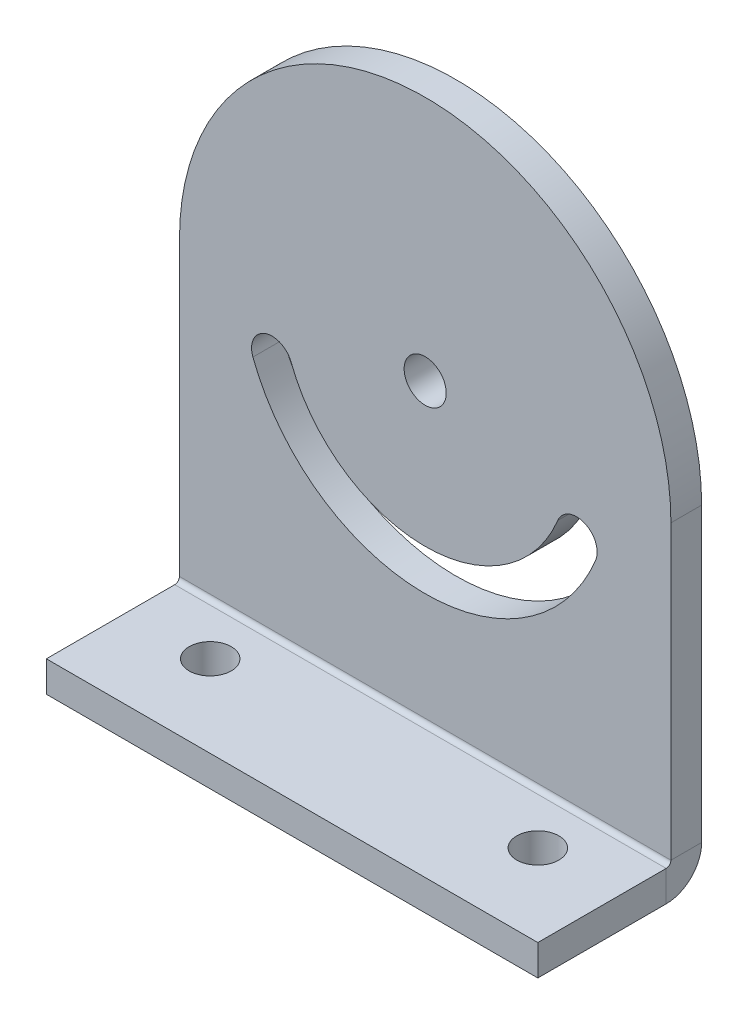
from build123d import *

# Parameters (mm, degrees)
BASE_FLANGE1_DEPTH                = 4.7625
EDGE_FLANGE2_STRIP_W              = 20.5232
EDGE_FLANGE2_STRIP_H              = 4.7625
EDGE_FLANGE2_STRIP_CUT_DEPTH      = 76.2
EDGE_FLANGE2_DEPTH                = 76.2
F_1_4_START                       = -50.8
F_1_4_CLEARANCE_HOLE3_OUTLINE_R   = 3.2639
F_1_4_CLEARANCE_HOLE3_DEPTH       = 4.7625
F_1_4_START_2                     = -4.7625
F_1_4_CLEARANCE_HOLE3_2_OUTLINE_R = 3.2639
F_1_4_CLEARANCE_HOLE3_2_DEPTH     = 4.7625
CUT_EXTRUDE1_DEPTH                = 94.877507457


# Read off the part's stored shape, not the designer's step: 1/4 Clearance Hole3
# Sheet-metal steps are written as plain solids
with BuildPart() as part:
    # Sketch1 → Base-Flange1 (new body)
    with BuildSketch(Plane.XY):
        with BuildLine():
            Line((0, 0), (0, -50.8))
            Line((0, -50.8), (-76.2, -50.8))
            Line((-76.2, -50.8), (-76.2, 0))
            ThreePointArc((-76.2, 0), (-38.1, 38.1), (0, 0))
        make_face()
    extrude(amount=-BASE_FLANGE1_DEPTH)

    # Edge-Flange2 strip (across the edge) → Edge-Flange2 strip cut (cut)
    with BuildSketch(Plane(origin=(-76.2, -50.8, 0), x_dir=(0, 1, 0), z_dir=(1, 0, 0))):
        with Locations((-4.7625, -2.38125)):
            Rectangle(EDGE_FLANGE2_STRIP_W, EDGE_FLANGE2_STRIP_H)
    extrude(amount=EDGE_FLANGE2_STRIP_CUT_DEPTH, mode=Mode.SUBTRACT)

    # Edge-Flange2 section (across the edge) → Edge-Flange2 (add)
    with BuildSketch(Plane(origin=(-76.2, -50.8, 0), x_dir=(0, 1, 0), z_dir=(1, 0, 0))):
        with BuildLine():
            Line((0, 0.7366), (0, 20.6375))
            Line((0, 20.6375), (4.7625, 20.6375))
            Line((4.7625, 20.6375), (4.7625, 0.7366))
            ThreePointArc((4.7625, 0.7366), (4.978245145, 0.215745145), (5.4991, 0))
            Line((5.4991, 0), (5.4991, -4.7625))
            ThreePointArc((5.4991, -4.7625), (1.6106491, -3.1518509), (0, 0.7366))
        make_face()
    extrude(amount=EDGE_FLANGE2_DEPTH)

    # 1/4 Clearance Hole3 outline → 1/4 Clearance Hole3 (cut)
    with BuildSketch(Plane(origin=(0, 0, 0), x_dir=(1, 0, 0), z_dir=(0, 1, 0)).offset(F_1_4_START)):
        with Locations((-12.7, -7.9375)):
            Circle(F_1_4_CLEARANCE_HOLE3_OUTLINE_R)
        with Locations((-63.5, -7.9375)):
            Circle(F_1_4_CLEARANCE_HOLE3_OUTLINE_R)
    extrude(amount=F_1_4_CLEARANCE_HOLE3_DEPTH, mode=Mode.SUBTRACT)

    # 1_4 Clearance Hole3 2 outline → 1_4 Clearance Hole3 2 (cut)
    with BuildSketch(Plane.XY.offset(F_1_4_START_2)):
        with Locations((-38.1, 0)):
            Circle(F_1_4_CLEARANCE_HOLE3_2_OUTLINE_R)
    extrude(amount=F_1_4_CLEARANCE_HOLE3_2_DEPTH, mode=Mode.SUBTRACT)

    # Sketch25 → Cut-Extrude1 (cut, through all)
    with BuildSketch(Plane.XY):
        with BuildLine():
            ThreePointArc((-64.811855715, -10.149255602), (-38.48848332, -28.57235912), (-11.673955742, -10.871743644))
            ThreePointArc((-11.673955742, -10.871743644), (-13.402211365, -6.727544988), (-17.546410021, -8.455800612))
            ThreePointArc((-17.546410021, -8.455800612), (-38.402153693, -22.222945983), (-58.875887778, -7.893865468))
            ThreePointArc((-58.875887778, -7.893865468), (-62.971566813, -6.053576567), (-64.811855715, -10.149255602))
        make_face()
    extrude(amount=-CUT_EXTRUDE1_DEPTH, mode=Mode.SUBTRACT)


solid = part.part
